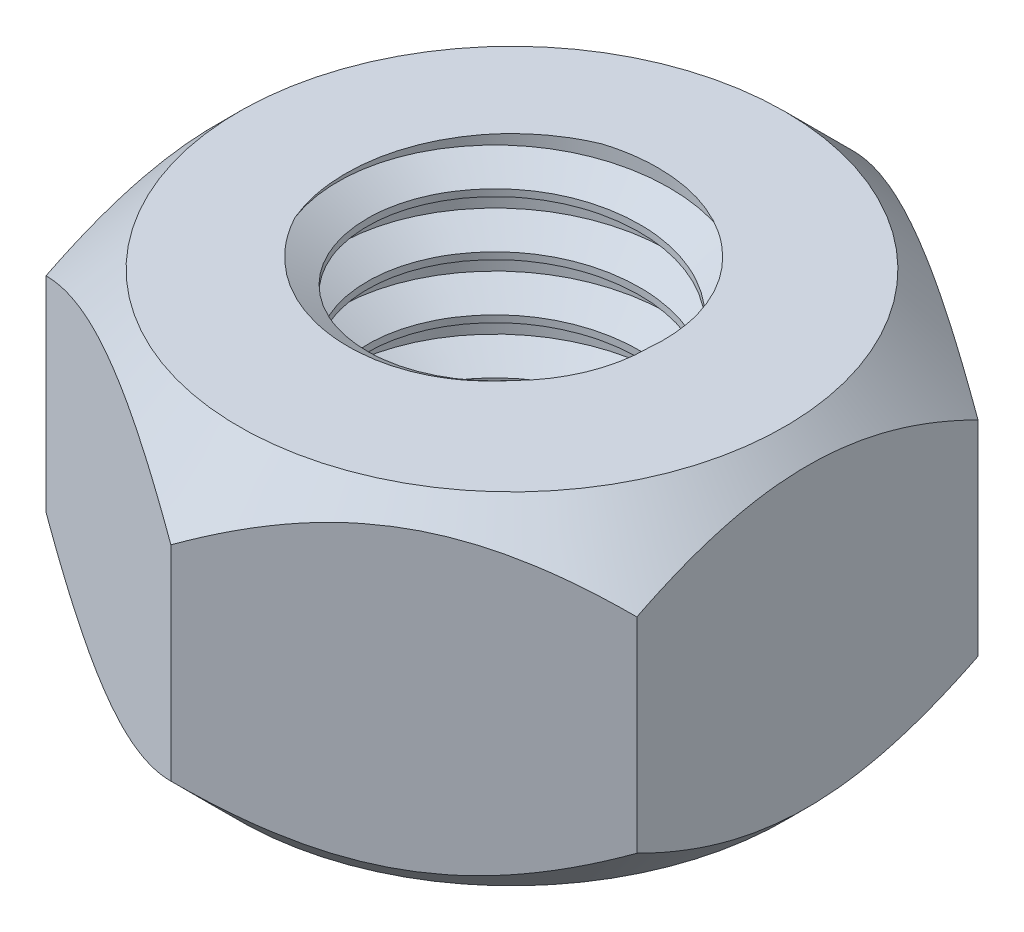
from build123d import *

# Parameters (mm, degrees)
BOSS_EXTRUDE1_DEPTH = 2.5
SKETCH2_R           = 2
CUT_EXTRUDE1_DEPTH  = 9.291561976
THREAD1_PITCH       = 0.8


with BuildPart() as part:
    # Sketch1 → Boss-Extrude1 (new, symmetric)
    with BuildSketch(Plane(origin=(0, 0, 0), x_dir=(1, 0, 0), z_dir=(0, 1, 0))):
        Polygon((0, 5), (-4.330127019, 2.5), (-4.330127019, -2.5), (0, -5), (4.330127019, -2.5), (4.330127019, 2.5), align=None)
    extrude(amount=BOSS_EXTRUDE1_DEPTH, both=True)

    # Sketch2 → Cut-Extrude1 (cut, through all)
    with BuildSketch(Plane(origin=(0, 2.5, 0), x_dir=(1, 0, 0), z_dir=(0, 1, 0))):
        with Locations(Location((0, 0, 0), (0, 0, 270))):
            Circle(SKETCH2_R)
    extrude(amount=-CUT_EXTRUDE1_DEPTH, mode=Mode.SUBTRACT)

    # Thread1: the profile of Thread Profile1 profile screwed along a right-hand helix of 12.5 turns, 8 arcs to a turn; built about Z, then put on its axis
    thread1_z = Axis((0, 0, 0), (0, 0, 1))
    thread1_corners = [(1.9997, 0, -0.000173205), (1.9997, 0, 0.700173203), (2.4330127, 0, 0.449999999), (2.4330127, 0, 0.249999999)]
    with BuildLine(mode=Mode.PRIVATE) as thread1_profile:
        Line(thread1_corners[0], thread1_corners[1])
        Line(thread1_corners[1], thread1_corners[2])
        Line(thread1_corners[2], thread1_corners[3])
        Line(thread1_corners[3], thread1_corners[0])
    thread1_cap = Face(thread1_profile.wire())
    thread1_turn_angles = [0, 22.5, 45, 67.5, 90, 112.5, 135, 157.5, 180, 202.5, 225, 247.5, 270, 292.5, 315, 337.5, 360]
    thread1_turn_weights = [1, 0.9238795325112867, 1, 0.9238795325112867, 1, 0.9238795325112867, 1, 0.9238795325112867, 1, 0.9238795325112867, 1, 0.9238795325112867, 1, 0.9238795325112867, 1, 0.9238795325112867, 1]
    thread1_turn_rails = [Edge.make_bspline([Vector(p[0], p[1], 0).rotate(thread1_z, thread1_turn_angles[k]) / thread1_turn_weights[k] + Vector(0, 0, p[2] + THREAD1_PITCH * thread1_turn_angles[k] / 360) for k in range(17)], [0, 0, 0, 1, 1, 2, 2, 3, 3, 4, 4, 5, 5, 6, 6, 7, 7, 8, 8, 8], 2, thread1_turn_weights) for p in thread1_corners]
    thread1_turn_sides = [Face.make_surface_from_curves(thread1_turn_rails[p[0]], thread1_turn_rails[p[1]]) for p in [(0, 1), (1, 2), (2, 3), (3, 0)]]
    thread1_last_angles = [4320, 4342.5, 4365, 4387.5, 4410, 4432.5, 4455, 4477.5, 4500]
    thread1_last_weights = [1, 0.9238795325112867, 1, 0.9238795325112867, 1, 0.9238795325112867, 1, 0.9238795325112867, 1]
    thread1_last_rails = [Edge.make_bspline([Vector(p[0], p[1], 0).rotate(thread1_z, thread1_last_angles[k]) / thread1_last_weights[k] + Vector(0, 0, p[2] + THREAD1_PITCH * thread1_last_angles[k] / 360) for k in range(9)], [0, 0, 0, 1, 1, 2, 2, 3, 3, 4, 4, 4], 2, thread1_last_weights) for p in thread1_corners]
    thread1_last_sides = [Face.make_surface_from_curves(thread1_last_rails[p[0]], thread1_last_rails[p[1]]) for p in [(0, 1), (1, 2), (2, 3), (3, 0)]]
    thread1 = Plane(origin=(0, 4.5, 0), x_dir=(-1, 0, 0), z_dir=(0, -1, 0)) * Solid(Shell([*[p.moved(Location((0, 0, THREAD1_PITCH * i))) for i in range(12) for p in thread1_turn_sides], *thread1_last_sides, thread1_cap, thread1_cap.rotate(thread1_z, 4500).moved(Location((0, 0, THREAD1_PITCH * 4500 / 360)))]))
    add(thread1, mode=Mode.SUBTRACT)

    # Sketch4 → Cut-Revolve2 (revolve, cut)
    with BuildSketch(Plane(origin=(0, 0, 0), x_dir=(0, 0, -1), z_dir=(1, 0, 0))):
        Polygon((5, 2.5), (4, 2.5), (5, 1.5), align=None)
    cut_revolve2 = revolve(axis=Axis((0, 0, 0), (0, 1, 0)), mode=Mode.SUBTRACT)

    # Mirror1: Cut-Revolve2 across plane
    add(cut_revolve2.mirror(Plane.ZX), mode=Mode.SUBTRACT)


solid = part.part
